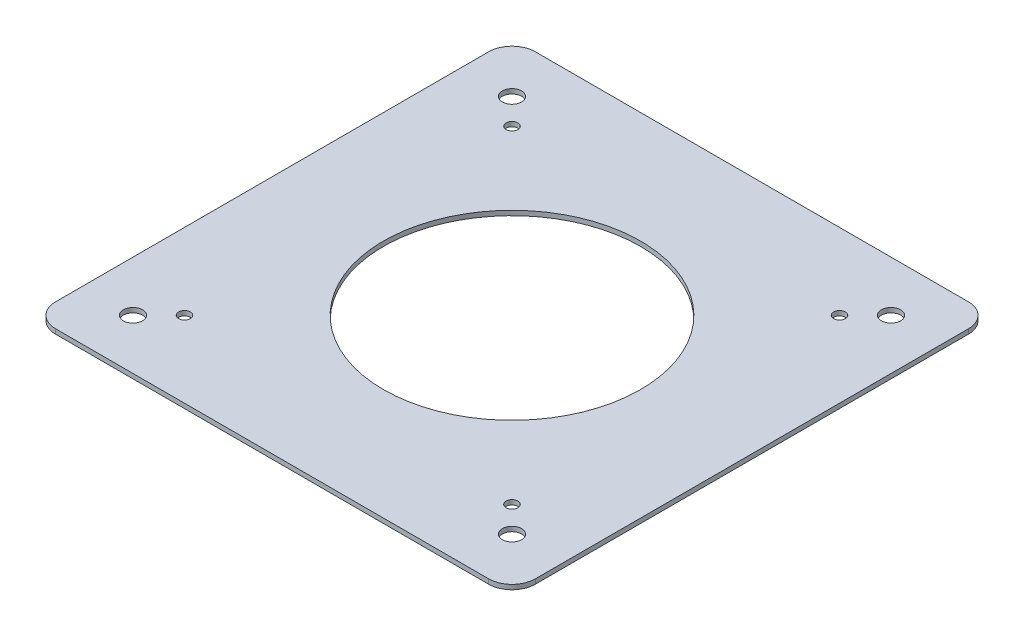
from build123d import *

# Parameters (mm, degrees)
BASE_FLANGE1_DEPTH = 1
SKETCH6_R          = 27.45
CUT_EXTRUDE1_DEPTH = 10
SKETCH8_R          = 2.05
SKETCH8_R_2        = 1.25
CUT_EXTRUDE2_DEPTH = 10
CIRPATTERN1_COUNT  = 4


# Sheet-metal steps are written as plain solids
with BuildPart() as part:
    # Sketch1 → Base-Flange1 (new body)
    with BuildSketch(Plane(origin=(0, 0, 0), x_dir=(1, 0, 0), z_dir=(0, 1, 0))):
        with BuildLine():
            Line((-46.2, -51.2), (46.2, -51.2))
            ThreePointArc((46.2, -51.2), (49.735533906, -49.735533906), (51.2, -46.2))
            Line((51.2, -46.2), (51.2, 46.2))
            ThreePointArc((51.2, 46.2), (49.735533906, 49.735533906), (46.2, 51.2))
            Line((46.2, 51.2), (-46.2, 51.2))
            ThreePointArc((-46.2, 51.2), (-49.735533906, 49.735533906), (-51.2, 46.2))
            Line((-51.2, 46.2), (-51.2, -46.2))
            ThreePointArc((-51.2, -46.2), (-49.735533906, -49.735533906), (-46.2, -51.2))
        make_face()
    extrude(amount=-BASE_FLANGE1_DEPTH)

    # Sketch6 → Cut-Extrude1 (cut)
    with BuildSketch(Plane(origin=(0, 0, 0), x_dir=(1, 0, 0), z_dir=(0, 1, 0))):
        with Locations(Location((0, 0, 0), (0, 0, 270))):
            Circle(SKETCH6_R)
    extrude(amount=-CUT_EXTRUDE1_DEPTH, mode=Mode.SUBTRACT)

    # Sketch8 → Cut-Extrude2 (cut)
    with BuildSketch(Plane(origin=(0, 0, 0), x_dir=(1, 0, 0), z_dir=(0, 1, 0))):
        with Locations(Location((40.45, 40.45, 0), (0, 0, 270))):
            Circle(SKETCH8_R)
        with Locations(Location((34.95, 34.95, 0), (0, 0, 270))):
            Circle(SKETCH8_R_2)
    cut_extrude2 = extrude(amount=-CUT_EXTRUDE2_DEPTH, mode=Mode.SUBTRACT)

    # CirPattern1: Cut-Extrude2 ×4 about axis
    cirpattern1_axis = Axis((0, 0, 0), (0, 1, 0))
    for i in range(1, CIRPATTERN1_COUNT):
        add(cut_extrude2.rotate(cirpattern1_axis, i * 360 / CIRPATTERN1_COUNT), mode=Mode.SUBTRACT)


solid = part.part
